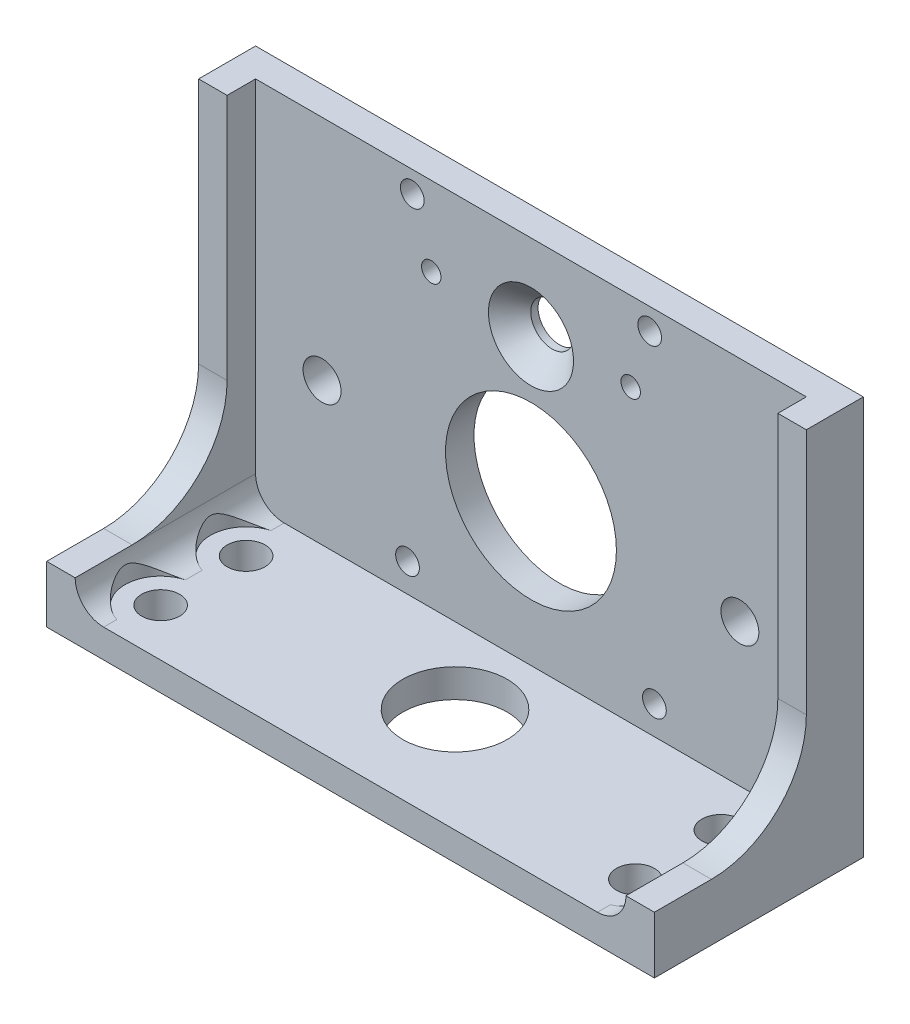
from build123d import *

# Parameters (mm, degrees)
SKETCH1_W                                            = 64
SKETCH1_H                                            = 39
SKETCH1_R                                            = 9
BOSS_EXTRUDE1_DEPTH                                  = 3
SKETCH2_W                                            = 3
SKETCH2_H                                            = 39
BOSS_EXTRUDE2_DEPTH                                  = 3
SKETCH3_W                                            = 64
SKETCH3_H                                            = 22
BOSS_EXTRUDE3_DEPTH                                  = 3
SKETCH4_W                                            = 3
SKETCH4_H                                            = 16
BOSS_EXTRUDE4_DEPTH                                  = 3
FILLET1_R                                            = 10
F_4_0_4_DIAMETER_HOLE1_D                             = 4
F_4_0_4_DIAMETER_HOLE1_DEPTH                         = 15
F_4_0_4_DIAMETER_HOLE1_TIP                           = 1.201721238
CSK_FOR_M4_HEX_SOCKET_COUNTERSUNK_CAP_SC_D           = 4.5
CSK_FOR_M4_HEX_SOCKET_COUNTERSUNK_CAP_SC_DEPTH       = 10
CSK_FOR_M4_HEX_SOCKET_COUNTERSUNK_CAP_SC_CSINK_D     = 8.96
CSK_FOR_M4_HEX_SOCKET_COUNTERSUNK_CAP_SC_CSINK_ANGLE = 90
CSK_FOR_M4_HEX_SOCKET_COUNTERSUNK_CAP_SC_TIP         = 1.351936393
M2_5_TAPPED_HOLE1_D                                  = 2.05
M2_5_TAPPED_HOLE1_DEPTH                              = 7.25
M2_5_TAPPED_HOLE1_TIP                                = 0.615882135
M3_TAPPED_HOLE1_D                                    = 2.5
M3_TAPPED_HOLE1_DEPTH                                = 8.5
M3_TAPPED_HOLE1_TIP                                  = 0.751075774
FILLET4_R                                            = 3
SKETCH19_R                                           = 2
CUT_EXTRUDE1_DEPTH                                   = 10
SKETCH20_R                                           = 5.5
CUT_EXTRUDE2_DEPTH                                   = 10
SKETCH21_R                                           = 3.75
CUT_EXTRUDE3_DEPTH                                   = 10


with BuildPart() as part:
    # Sketch1 → Boss-Extrude1 (new body)
    with BuildSketch(Plane.XY):
        with Locations((0, 4.5)):
            Rectangle(SKETCH1_W, SKETCH1_H)
        Circle(SKETCH1_R, mode=Mode.SUBTRACT)
    extrude(amount=BOSS_EXTRUDE1_DEPTH)

    # Sketch2 → Boss-Extrude2 (add)
    with BuildSketch(Plane.XY.offset(3)):
        with Locations((-30.5, 4.5)):
            Rectangle(SKETCH2_W, SKETCH2_H)
        with Locations((30.5, 4.5)):
            Rectangle(SKETCH2_W, SKETCH2_H)
    extrude(amount=BOSS_EXTRUDE2_DEPTH)

    # Sketch3 → Boss-Extrude3 (add)
    with BuildSketch(Plane.XZ.offset(15)):
        with Locations((0, 11)):
            Rectangle(SKETCH3_W, SKETCH3_H)
    extrude(amount=BOSS_EXTRUDE3_DEPTH)

    # Sketch4 → Boss-Extrude4 (add)
    with BuildSketch(Plane(origin=(0, -15, 0), x_dir=(1, 0, 0), z_dir=(0, 1, 0))):
        with Locations((-30.5, -14)):
            Rectangle(SKETCH4_W, SKETCH4_H)
        with Locations((30.5, -14)):
            Rectangle(SKETCH4_W, SKETCH4_H)
    extrude(amount=BOSS_EXTRUDE4_DEPTH)

    # Fillet1
    fillet1_edges = [part.edges().sort_by_distance(p)[0] for p in [
        (-30.5, -12, 6),
        (30.5, -12, 6),
    ]]
    fillet(fillet1_edges, radius=FILLET1_R)

    # Ø4.0 (4) Diameter Hole1
    with Locations(Plane(origin=(0, 0, 0), x_dir=(-1, 0, 0), z_dir=(0, 0, -1))):
        with Locations((-22, 0), (22, 0)):
            Hole(F_4_0_4_DIAMETER_HOLE1_D / 2, depth=F_4_0_4_DIAMETER_HOLE1_DEPTH)
            with Locations((0, 0, -(F_4_0_4_DIAMETER_HOLE1_DEPTH + F_4_0_4_DIAMETER_HOLE1_TIP / 2))):  # 118° drill point
                Cone(0, F_4_0_4_DIAMETER_HOLE1_D / 2, F_4_0_4_DIAMETER_HOLE1_TIP, mode=Mode.SUBTRACT)

    # CSK for M4 Hex Socket Countersunk Cap Screw1
    with Locations(Plane.XY.offset(3)):
        with Locations((0, 15)):
            CounterSinkHole(CSK_FOR_M4_HEX_SOCKET_COUNTERSUNK_CAP_SC_D / 2, CSK_FOR_M4_HEX_SOCKET_COUNTERSUNK_CAP_SC_CSINK_D / 2, depth=CSK_FOR_M4_HEX_SOCKET_COUNTERSUNK_CAP_SC_DEPTH, counter_sink_angle=CSK_FOR_M4_HEX_SOCKET_COUNTERSUNK_CAP_SC_CSINK_ANGLE)
            with Locations((0, 0, -(CSK_FOR_M4_HEX_SOCKET_COUNTERSUNK_CAP_SC_DEPTH + CSK_FOR_M4_HEX_SOCKET_COUNTERSUNK_CAP_SC_TIP / 2))):  # 118° drill point
                Cone(0, CSK_FOR_M4_HEX_SOCKET_COUNTERSUNK_CAP_SC_D / 2, CSK_FOR_M4_HEX_SOCKET_COUNTERSUNK_CAP_SC_TIP, mode=Mode.SUBTRACT)

    # M2.5 Tapped Hole1
    with Locations(Plane.XY.offset(3)):
        with Locations((-10.5, 15.66), (10.5, 15.66)):
            Hole(M2_5_TAPPED_HOLE1_D / 2, depth=M2_5_TAPPED_HOLE1_DEPTH)
            with Locations((0, 0, -(M2_5_TAPPED_HOLE1_DEPTH + M2_5_TAPPED_HOLE1_TIP / 2))):  # 118° drill point
                Cone(0, M2_5_TAPPED_HOLE1_D / 2, M2_5_TAPPED_HOLE1_TIP, mode=Mode.SUBTRACT)

    # M3 Tapped Hole1
    with Locations(Plane.XY.offset(3)):
        with Locations((-12.5, 21.75), (12.5, 21.75), (13, -12), (-13, -12)):
            Hole(M3_TAPPED_HOLE1_D / 2, depth=M3_TAPPED_HOLE1_DEPTH)
            with Locations((0, 0, -(M3_TAPPED_HOLE1_DEPTH + M3_TAPPED_HOLE1_TIP / 2))):  # 118° drill point
                Cone(0, M3_TAPPED_HOLE1_D / 2, M3_TAPPED_HOLE1_TIP, mode=Mode.SUBTRACT)

    # Fillet4
    fillet4_edges = [part.edges().sort_by_distance(p)[0] for p in [
        (29, -15, 12.5),
        (-29, -15, 12.5),
    ]]
    fillet(fillet4_edges, radius=FILLET4_R - 0.0001)  # a hair under: the kernel refuses the full size

    # Sketch19 → Cut-Extrude1 (cut)
    with BuildSketch(Plane.XZ.offset(18)):
        with Locations(Location((-25, 8, 0), (0, 0, 270))):
            Circle(SKETCH19_R)
        with Locations(Location((25, 8, 0), (0, 0, 270))):
            Circle(SKETCH19_R)
        with Locations(Location((-25, 17, 0), (0, 0, 270))):
            Circle(SKETCH19_R)
        with Locations(Location((25, 17, 0), (0, 0, 270))):
            Circle(SKETCH19_R)
    extrude(amount=-CUT_EXTRUDE1_DEPTH, mode=Mode.SUBTRACT)

    # Sketch20 → Cut-Extrude2 (cut)
    with BuildSketch(Plane(origin=(0, -15, 0), x_dir=(1, 0, 0), z_dir=(0, 1, 0))):
        with Locations(Location((0, -11, 0), (0, 0, 270))):
            Circle(SKETCH20_R)
    extrude(amount=-CUT_EXTRUDE2_DEPTH, mode=Mode.SUBTRACT)

    # Sketch21 → Cut-Extrude3 (cut)
    with BuildSketch(Plane(origin=(0, -15, 0), x_dir=(1, 0, 0), z_dir=(0, 1, 0))):
        with Locations((-25, -8)):
            Circle(SKETCH21_R)
        with Locations((-25, -17)):
            Circle(SKETCH21_R)
        with Locations((25, -8)):
            Circle(SKETCH21_R)
        with Locations((25, -17)):
            Circle(SKETCH21_R)
    extrude(amount=CUT_EXTRUDE3_DEPTH, mode=Mode.SUBTRACT)


solid = part.part
